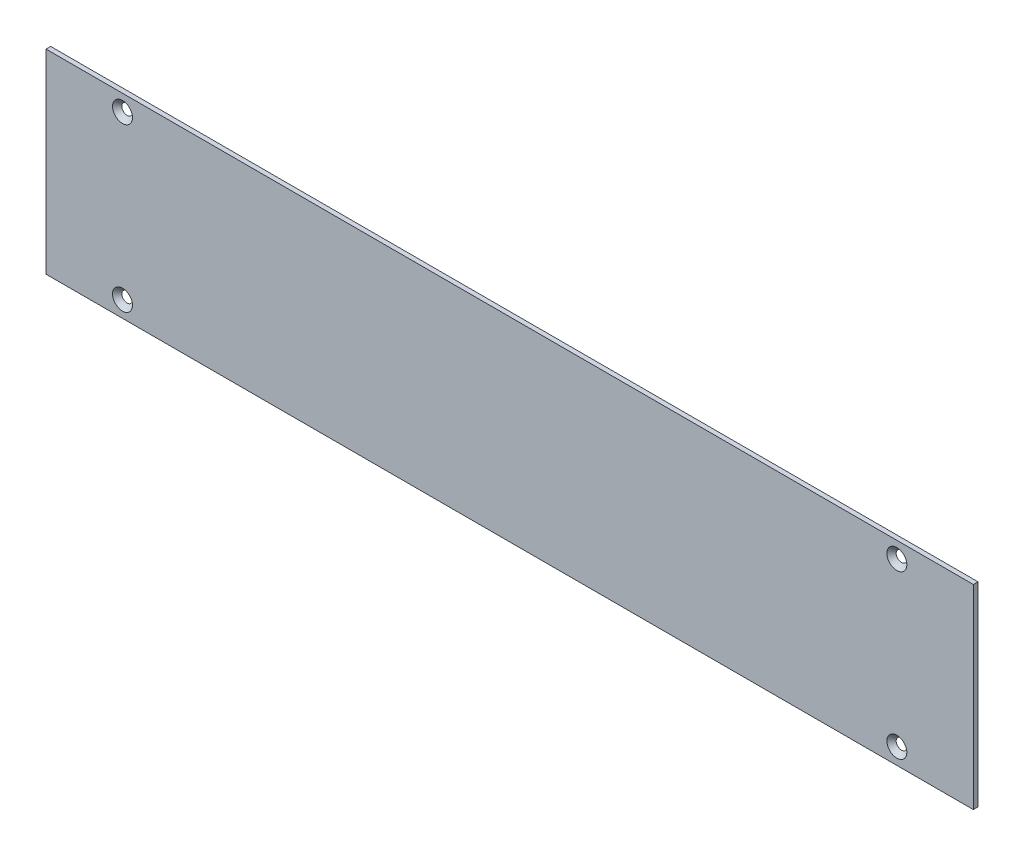
from build123d import *

# Parameters (mm, degrees)
SKETCH_1_W          = 400
SKETCH_1_H          = 84.1
EXTRUDE_1_DEPTH     = 2
SKETCH_2_R          = 2.25
CUT_EXTRUDE_1_DEPTH = 409.750302752
CHAMFER_1_SIZE      = 2.05


with BuildPart() as part:
    # Эскиз1 → Бобышка-Вытянуть1 (new body)
    with BuildSketch(Plane.XY):
        with Locations((200, 42.05)):
            Rectangle(SKETCH_1_W, SKETCH_1_H)
    extrude(amount=EXTRUDE_1_DEPTH)

    # Эскиз2 → Вырез-Вытянуть1 (cut, through all)
    with BuildSketch(Plane.XY.offset(2)):
        with Locations((33, 77.1)):
            Circle(SKETCH_2_R)
        with Locations((367, 77.1)):
            Circle(SKETCH_2_R)
        with Locations((367, 7)):
            Circle(SKETCH_2_R)
        with Locations((33, 7)):
            Circle(SKETCH_2_R)
    extrude(amount=-CUT_EXTRUDE_1_DEPTH, mode=Mode.SUBTRACT)

    # Фаска1
    # the kernel refuses this chamfer: 2.05 mm, written as the material it takes off along each edge
    with BuildSketch(Plane(origin=(367, 7, 2), x_dir=(1, 0, 0), z_dir=(0, -1, 0))) as chamfer_1_piece_1:
        Polygon((2.25 + CHAMFER_1_SIZE, 0), (2.25, -CHAMFER_1_SIZE), (2.25, 0), align=None)
    revolve(axis=Axis((367, 7, 2), (0, 0, 1)), mode=Mode.SUBTRACT)
    with BuildSketch(Plane(origin=(367, 77.1, 2), x_dir=(1, 0, 0), z_dir=(0, -1, 0))) as chamfer_1_piece_2:
        Polygon((2.25 + CHAMFER_1_SIZE, 0), (2.25, -CHAMFER_1_SIZE), (2.25, 0), align=None)
    revolve(axis=Axis((367, 77.1, 2), (0, 0, 1)), mode=Mode.SUBTRACT)
    with BuildSketch(Plane(origin=(33, 7, 2), x_dir=(1, 0, 0), z_dir=(0, -1, 0))) as chamfer_1_piece_3:
        Polygon((2.25 + CHAMFER_1_SIZE, 0), (2.25, -CHAMFER_1_SIZE), (2.25, 0), align=None)
    revolve(axis=Axis((33, 7, 2), (0, 0, 1)), mode=Mode.SUBTRACT)
    with BuildSketch(Plane(origin=(33, 77.1, 2), x_dir=(1, 0, 0), z_dir=(0, -1, 0))) as chamfer_1_piece_4:
        Polygon((2.25 + CHAMFER_1_SIZE, 0), (2.25, -CHAMFER_1_SIZE), (2.25, 0), align=None)
    revolve(axis=Axis((33, 77.1, 2), (0, 0, 1)), mode=Mode.SUBTRACT)


solid = part.part
